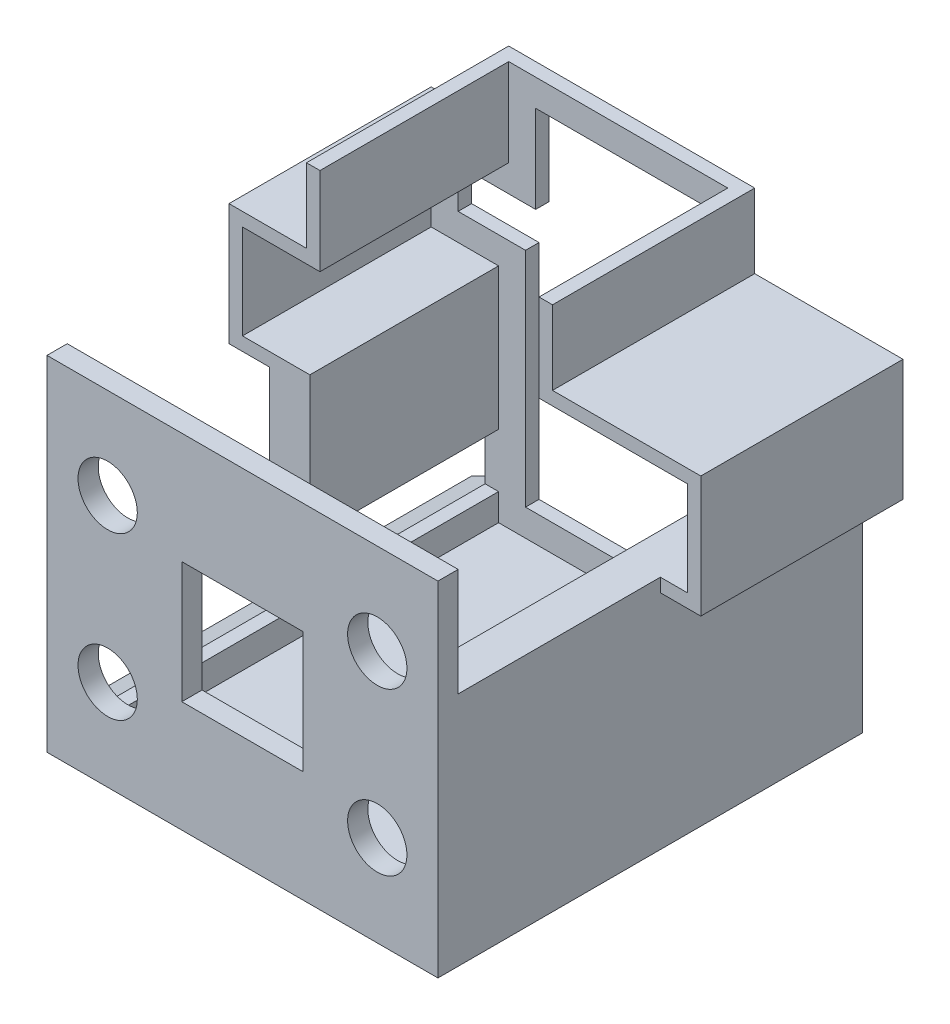
from build123d import *

# Parameters (mm, degrees)
EXTRUDE_1_DEPTH        = 15
CUT_EXTRUDE_1_DEPTH    = 14
SKETCH_7_W             = 46
SKETCH_7_H             = 6
CUT_EXTRUDE_2_DEPTH    = 1
SKETCH_8_W             = 14
SKETCH_8_H             = 4
CUT_EXTRUDE_3_DEPTH    = 1
CUT_EXTRUDE_6_DEPTH    = 1
EXTRUDE_START          = -30
EXTRUDE_10_OUTLINE_W   = 3
EXTRUDE_10_OUTLINE_H   = 17.5
EXTRUDE_10_OUTLINE_H_2 = 10.5
EXTRUDE_10_OUTLINE_W_2 = 9
EXTRUDE_10_OUTLINE_H_3 = 1
EXTRUDE_10_OUTLINE_W_3 = 2
EXTRUDE_10_DEPTH       = 30
SKETCH_29_W            = 29
SKETCH_29_H            = 25.5
EXTRUDE_12_DEPTH       = 1.5
SKETCH_30_R            = 2.2
SKETCH_30_W            = 9
SKETCH_30_H            = 9
CUT_EXTRUDE_8_DEPTH    = 1.5
SKETCH_31_W            = 1.75
SKETCH_31_H            = 1
EXTRUDE_13_DEPTH       = 15
SKETCH_33_W            = 9
SKETCH_33_H            = 1
SKETCH_33_W_2          = 3.75
CUT_EXTRUDE_9_DEPTH    = 15
SKETCH_38_W            = 3
SKETCH_38_H            = 10.5
CUT_EXTRUDE_11_DEPTH   = 15
SKETCH_39_W            = 29
SKETCH_39_H            = 1
EXTRUDE_14_DEPTH       = 30
SKETCH_40_W            = 48
SKETCH_40_H            = 8
CUT_EXTRUDE_12_DEPTH   = 15


# Read off the part's stored shape, not the designer's step: 凸台-拉伸10
with BuildPart() as part:
    # 草图3 → 凸台-拉伸1 (new body)
    with BuildSketch(Plane.XY):
        Polygon((-25, 21.5), (23, 21.5), (23, 13.5), (6.5, 13.5), (6.5, 8), (17.5, 8), (17.5, -1), (12.5, -1), (12.5, -17.5), (-12.5, -17.5), (-12.5, -1), (-17.5, -1), (-17.5, 8), (-11.75, 8), (-11.75, 13.5), (-25, 13.5), align=None)
    extrude(amount=EXTRUDE_1_DEPTH)

    # 草图4 → 切除-拉伸1 (cut)
    with BuildSketch(Plane.XY.offset(15)):
        Polygon((22, 20.5), (-24, 20.5), (-24, 14.5), (-10.75, 14.5), (-10.75, 7), (-16.5, 7), (-16.5, 0), (-11.5, 0), (-11.5, -16.5), (11.5, -16.5), (11.5, 0), (16.5, 0), (16.5, 7), (5.5, 7), (5.5, 14.5), (22, 14.5), align=None)
    extrude(amount=-CUT_EXTRUDE_1_DEPTH, mode=Mode.SUBTRACT)

    # 草图7 → 切除-拉伸2 (cut)
    with BuildSketch(Plane.XY.offset(1)):
        with Locations((-1, 17.5)):
            Rectangle(SKETCH_7_W, SKETCH_7_H)
    extrude(amount=-CUT_EXTRUDE_2_DEPTH, mode=Mode.SUBTRACT)

    # 草图8 → 切除-拉伸3 (cut)
    with BuildSketch(Plane.ZY.offset(12.5)):
        with Locations((8, -12.5)):
            Rectangle(SKETCH_8_W, SKETCH_8_H)
    extrude(amount=-CUT_EXTRUDE_3_DEPTH, mode=Mode.SUBTRACT)

    # 草图9 → 切除-拉伸6 (cut)
    with BuildSketch(Plane(origin=(0, 0, 0), x_dir=(-1, 0, 0), z_dir=(0, 0, -1))):
        Polygon((-3.5, 11.5), (-3.5, 5), (-14.5, 5), (-14.5, 2), (-9.5, 2), (-9.5, -14.5), (9.5, -14.5), (9.5, 2), (14.5, 2), (14.5, 5), (8.75, 5), (8.75, 11.5), align=None)
    extrude(amount=-CUT_EXTRUDE_6_DEPTH, mode=Mode.SUBTRACT)

    # 凸台-拉伸10 outline → 凸台-拉伸10 (add)
    with BuildSketch(Plane(origin=(0, 0, 0), x_dir=(-1, 0, 0), z_dir=(0, 0, -1)).offset(EXTRUDE_START)):
        with Locations((-13, -8.75)):
            Rectangle(EXTRUDE_10_OUTLINE_W, EXTRUDE_10_OUTLINE_H)
        Polygon((14.5, -15.5), (12.5, -14.5), (11.5, -14.5), (11.5, -17.5), (14.5, -17.5), align=None)
        with Locations((13, -5.25)):
            Rectangle(EXTRUDE_10_OUTLINE_W, EXTRUDE_10_OUTLINE_H_2)
        with Locations((-10, 7.5)):
            Rectangle(EXTRUDE_10_OUTLINE_W_2, EXTRUDE_10_OUTLINE_H_3)
        with Locations((13.5, 7.5)):
            Rectangle(EXTRUDE_10_OUTLINE_W_3, EXTRUDE_10_OUTLINE_H_3)
    extrude(amount=EXTRUDE_10_DEPTH)

    # 草图29 → 凸台-拉伸12 (add)
    with BuildSketch(Plane.XY.offset(30)):
        with Locations((0, -4.75)):
            Rectangle(SKETCH_29_W, SKETCH_29_H)
    extrude(amount=EXTRUDE_12_DEPTH)

    # 草图30 → 切除-拉伸8 (cut)
    with BuildSketch(Plane.XY.offset(31.5)):
        with Locations((-10, 1.25)):
            Circle(SKETCH_30_R)
        with Locations((-10, -10.75)):
            Circle(SKETCH_30_R)
        with Locations((10, 1.25)):
            Circle(SKETCH_30_R)
        with Locations((10, -10.75)):
            Circle(SKETCH_30_R)
        with Locations((0, -4.75)):
            Rectangle(SKETCH_30_W, SKETCH_30_H)
    extrude(amount=-CUT_EXTRUDE_8_DEPTH, mode=Mode.SUBTRACT)

    # 草图31 → 凸台-拉伸13 (add)
    with BuildSketch(Plane.XY.offset(15)):
        with Locations((-11.625, 7.5)):
            Rectangle(SKETCH_31_W, SKETCH_31_H)
    extrude(amount=EXTRUDE_13_DEPTH)

    # 草图33 → 切除-拉伸9 (cut)
    with BuildSketch(Plane.XY.offset(15)):
        with Locations((10, 7.5)):
            Rectangle(SKETCH_33_W, SKETCH_33_H)
        with Locations((-12.625, 7.5)):
            Rectangle(SKETCH_33_W_2, SKETCH_33_H)
    extrude(amount=CUT_EXTRUDE_9_DEPTH, mode=Mode.SUBTRACT)

    # 草图38 → 切除-拉伸11 (cut)
    with BuildSketch(Plane.XY.offset(15)):
        with Locations((-13, -5.25)):
            Rectangle(SKETCH_38_W, SKETCH_38_H)
    extrude(amount=CUT_EXTRUDE_11_DEPTH, mode=Mode.SUBTRACT)

    # 草图39 → 凸台-拉伸14 (add)
    with BuildSketch(Plane(origin=(0, 0, 0), x_dir=(-1, 0, 0), z_dir=(0, 0, -1))):
        with Locations((0, -17)):
            Rectangle(SKETCH_39_W, SKETCH_39_H)
    extrude(amount=-EXTRUDE_14_DEPTH)

    # 草图40 → 切除-拉伸12 (cut)
    with BuildSketch(Plane(origin=(0, 0, 0), x_dir=(-1, 0, 0), z_dir=(0, 0, -1))):
        with Locations((1, 17.5)):
            Rectangle(SKETCH_40_W, SKETCH_40_H)
    extrude(amount=-CUT_EXTRUDE_12_DEPTH, mode=Mode.SUBTRACT)


solid = part.part
